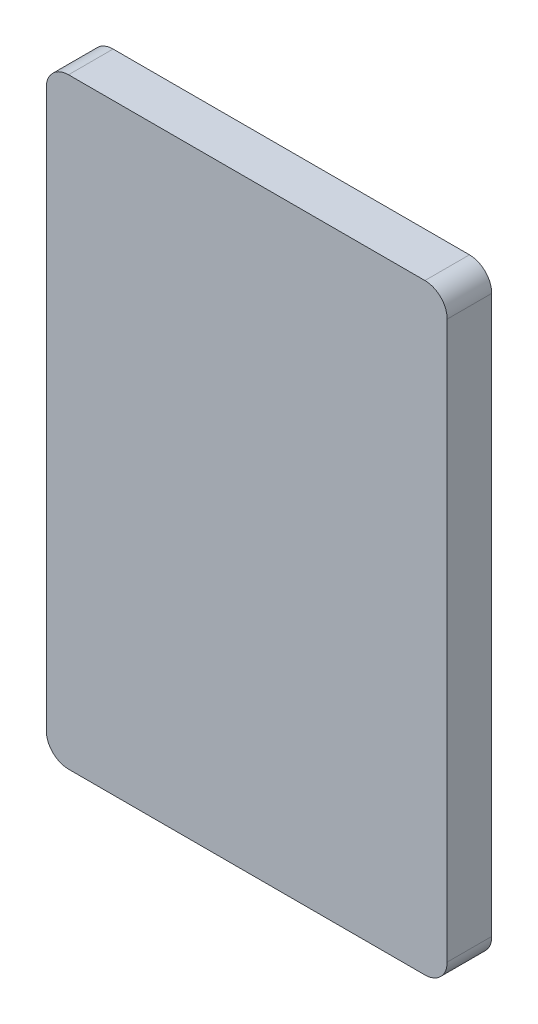
from build123d import *

# Parameters (mm, degrees)
SKETCH1_W  = 18
SKETCH1_H  = 27
BASE_DEPTH = 2
FILLET_2_R = 1


with BuildPart() as part:
    # Sketch1 → Base (new body)
    with BuildSketch(Plane.XY):
        Rectangle(SKETCH1_W, SKETCH1_H)
    extrude(amount=BASE_DEPTH)

    # Fillet 2
    fillet_2_edges = [part.edges().sort_by_distance(p)[0] for p in [
        (9, 13.5, 1),
        (9, -13.5, 1),
        (-9, -13.5, 1),
        (-9, 13.5, 1),
    ]]
    fillet(fillet_2_edges, radius=FILLET_2_R)


solid = part.part
